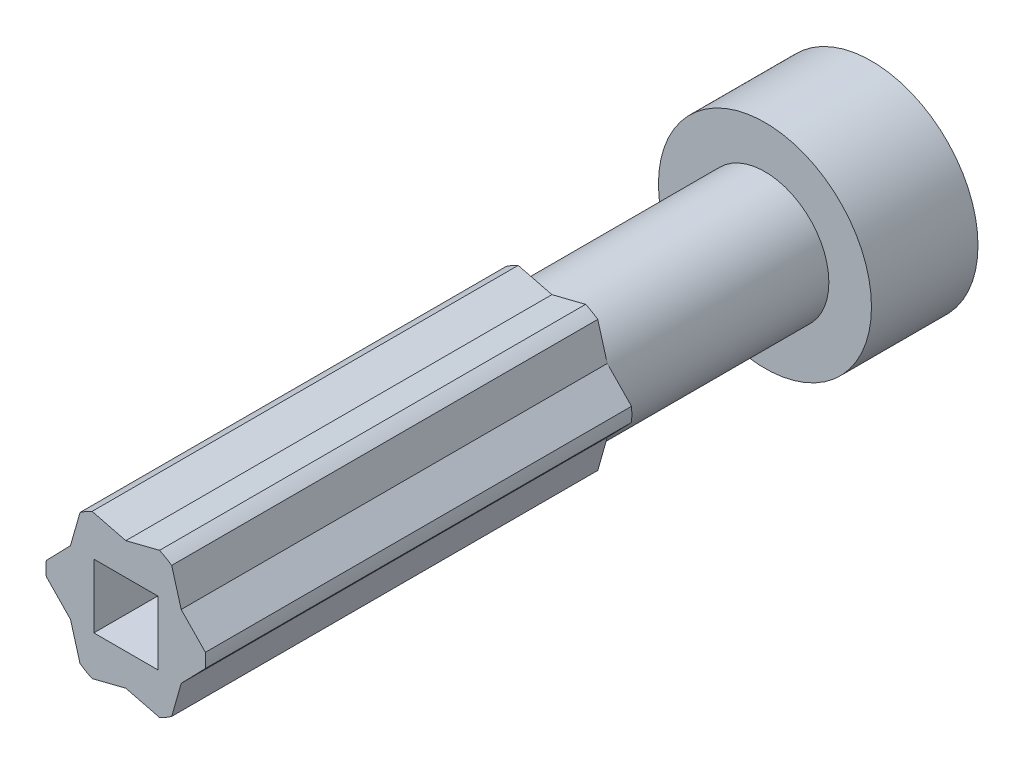
from build123d import *

# Parameters (mm, degrees)
SKETCH1_R           = 3.81
BOSS_EXTRUDE1_DEPTH = 38.1
SKETCH2_R           = 6.35
BOSS_EXTRUDE2_DEPTH = 6.35
SKETCH6_R           = 2.8575
BOSS_EXTRUDE3_DEPTH = 2.54
SKETCH14_W          = 3.81
SKETCH14_H          = 3.81
CUT_EXTRUDE1_DEPTH  = 38.1
BOSS_EXTRUDE5_START = -25.4
BOSS_EXTRUDE5_DEPTH = 25.4
SKETCH16_R          = 1.5875
CUT_EXTRUDE2_DEPTH  = 25.4


# Read off the part's stored shape, not the designer's step: Boss-Extrude5
with BuildPart() as part:
    # Sketch1 → Boss-Extrude1 (new body)
    with BuildSketch(Plane.XY):
        with Locations(Location((0, 0, 0), (0, 0, 180))):
            Circle(SKETCH1_R)
    extrude(amount=BOSS_EXTRUDE1_DEPTH)

    # Sketch2 → Boss-Extrude2 (add)
    with BuildSketch(Plane(origin=(0, 0, 0), x_dir=(-1, 0, 0), z_dir=(0, 0, -1))):
        Circle(SKETCH2_R)
    extrude(amount=BOSS_EXTRUDE2_DEPTH)

    # Sketch6 → Boss-Extrude3 (add)
    with BuildSketch(Plane.XY.offset(38.1)):
        Circle(SKETCH6_R)
    extrude(amount=-BOSS_EXTRUDE3_DEPTH)

    # Sketch14 → Cut-Extrude1 (cut)
    with BuildSketch(Plane.XY.offset(38.1)):
        Rectangle(SKETCH14_W, SKETCH14_H)
    extrude(amount=-CUT_EXTRUDE1_DEPTH, mode=Mode.SUBTRACT)

    # Boss-Extrude5 outline → Boss-Extrude5 (add)
    with BuildSketch(Plane.XY.offset(38.1).offset(BOSS_EXTRUDE5_START)):
        with BuildLine():
            ThreePointArc((-3.298088459, 1.907540961), (-1.903729096, 3.300290219), (0, 3.81))
            Line((0, 3.81), (-2.010168305, 4.316182263))
            ThreePointArc((-2.010168305, 4.316182263), (-2.380206411, 4.123596348), (-2.731973317, 3.899369726))
            Line((-2.731973317, 3.899369726), (-3.298088459, 1.907540961))
        make_face()
        with BuildLine():
            Line((2.011093908, 4.31641534), (0, 3.81))
            ThreePointArc((0, 3.81), (3.809999869, 0.001000002), (0.002000005, -3.809999475))
            Line((0.002000005, -3.809999475), (2.011795704, -4.316088438))
            ThreePointArc((2.011795704, -4.316088438), (2.38208523, -4.123386397), (2.734078384, -3.899000058))
            Line((2.734078384, -3.899000058), (3.301056788, -1.904133975))
            Line((3.301056788, -1.904133975), (4.744240085, -0.416644057))
            ThreePointArc((4.744240085, -0.416644057), (4.762499984, 0.000387099), (4.744172292, 0.417415282))
            Line((4.744172292, 0.417415282), (3.300056788, 1.905866025))
            Line((3.300056788, 1.905866025), (2.73344438, 3.899444381))
            ThreePointArc((2.73344438, 3.899444381), (2.381414754, 4.123773496), (2.011093908, 4.31641534))
        make_face()
        with BuildLine():
            Line((-2.009093908, -4.31641534), (0.002000005, -3.809999475))
            ThreePointArc((0.002000005, -3.809999475), (-1.901999931, -3.301287062), (-3.29709076, -1.909264917))
            Line((-3.29709076, -1.909264917), (-2.73144438, -3.899444381))
            ThreePointArc((-2.73144438, -3.899444381), (-2.379414754, -4.123773496), (-2.009093908, -4.31641534))
        make_face()
        with BuildLine():
            ThreePointArc((-3.300524979, -1.90332206), (-3.80999987, -0.000996951), (-3.3015206, 1.901594523))
            Line((-3.3015206, 1.901594523), (-4.742240085, 0.416644057))
            ThreePointArc((-4.742240085, 0.416644057), (-4.760499984, -0.000387099), (-4.742172292, -0.417415282))
            Line((-4.742172292, -0.417415282), (-3.300524979, -1.90332206))
        make_face()
    extrude(amount=BOSS_EXTRUDE5_DEPTH)

    # Sketch16 → Cut-Extrude2 (cut)
    with BuildSketch(Plane(origin=(-1.905, 0, 0), x_dir=(0, 0, -1), z_dir=(1, 0, 0))):
        with Locations(Location((-3.175, 0, 0), (0, 0, 90))):
            Circle(SKETCH16_R)
    extrude(amount=-CUT_EXTRUDE2_DEPTH, mode=Mode.SUBTRACT)


solid = part.part
